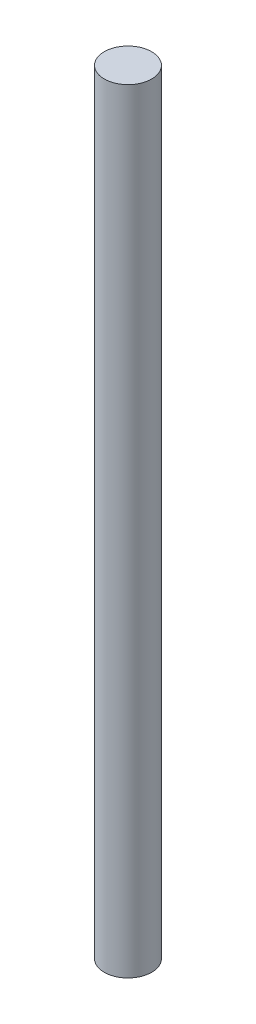
from build123d import *

# Parameters (mm, degrees)
SKETCH1_R           = 1.5
BOSS_EXTRUDE1_DEPTH = 24.5
SCALE1_SCALE        = 0.6


with BuildPart() as part:
    # Sketch1 → Boss-Extrude1 (new, symmetric)
    with BuildSketch(Plane(origin=(0, 0, 0), x_dir=(1, 0, 0), z_dir=(0, 1, 0))):
        Circle(SKETCH1_R)
    extrude(amount=BOSS_EXTRUDE1_DEPTH, both=True)


with BuildPart() as part_1:
    # Scale1: scaled about (0, 0, 0)
    add(part.part.scale(SCALE1_SCALE))


solid = part_1.part
